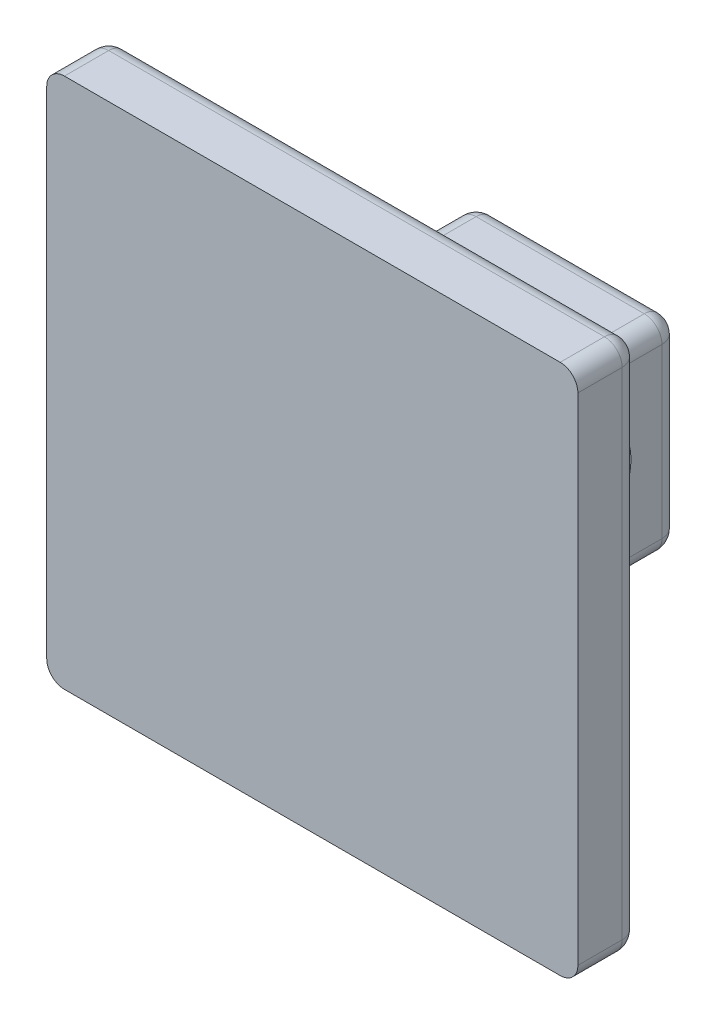
from build123d import *

# Parameters (mm, degrees)
ESBO_O1_W                = 23
ESBO_O1_H                = 23
RESSALTO_EXTRUS_O1_DEPTH = 23
ESBO_O3_W                = 60
ESBO_O3_H                = 60
RESSALTO_EXTRUS_O2_DEPTH = 7
ESBO_O6_R                = 6
CORTE_EXTRUS_O1_DEPTH    = 23
FILETE1_R                = 2
FILETE2_R                = 2
FILETE3_R                = 2


with BuildPart() as part:
    # Esboço1 → Ressalto-extrusão1 (new body)
    with BuildSketch(Plane.XY):
        Rectangle(ESBO_O1_W, ESBO_O1_H)
    extrude(amount=RESSALTO_EXTRUS_O1_DEPTH)

    # Esboço6 → Corte-extrusão1 (cut)
    with BuildSketch(Plane(origin=(11.5, 0, 0), x_dir=(0, 0, -1), z_dir=(1, 0, 0))):
        with Locations((-11.5, 0)):
            Circle(ESBO_O6_R)
    extrude(amount=-CORTE_EXTRUS_O1_DEPTH, mode=Mode.SUBTRACT)

    # Filete3
    filete3_edges = [part.edges().sort_by_distance(p)[0] for p in [
        (0, -11.5, 0),
        (-11.5, 0, 0),
        (0, 11.5, 0),
        (11.5, 0, 0),
        (11.5, -11.5, 11.5),
        (-11.5, -11.5, 11.5),
        (-11.5, 11.5, 11.5),
        (11.5, 11.5, 11.5),
    ]]
    fillet(filete3_edges, radius=FILETE3_R)


with BuildPart() as body_2:
    # Esboço3 → Ressalto-extrusão2 (new body)
    with BuildSketch(Plane.XY.offset(23)):
        Rectangle(ESBO_O3_W, ESBO_O3_H)
    extrude(amount=RESSALTO_EXTRUS_O2_DEPTH)

    # Filete1
    filete1_edges = [body_2.edges().sort_by_distance(p)[0] for p in [
        (0, 30, 23),
        (30, 0, 23),
        (0, -30, 23),
        (-30, 0, 23),
    ]]
    fillet(filete1_edges, radius=FILETE1_R)

    # Filete2
    # the kernel refuses this fillet: 2 mm, written as the material it takes off along each edge
    with BuildSketch(Plane(origin=(-28, -28, 25), x_dir=(-1, 0, 0), z_dir=(0, -1, 0))) as filete2_piece_1_section:
        Polygon((0, 0), (FILETE2_R, 0), (FILETE2_R, FILETE2_R), (0, FILETE2_R), align=None)
    filete2_piece_1 = extrude(amount=FILETE2_R, mode=Mode.PRIVATE)
    filete2_piece_1 = filete2_piece_1 - Plane(origin=(-28, -28, 25), x_dir=(0.7071067811865475, 0, 0.7071067811865475), z_dir=(0, -1, 0)) * Sphere(FILETE2_R, mode=Mode.PRIVATE)
    add(filete2_piece_1, mode=Mode.SUBTRACT)
    with BuildSketch(Plane(origin=(-28, 28, 25), x_dir=(0, 1, 0), z_dir=(-1, 0, 0))) as filete2_piece_2_section:
        Polygon((0, 0), (FILETE2_R, 0), (FILETE2_R, FILETE2_R), (0, FILETE2_R), align=None)
    filete2_piece_2 = extrude(amount=FILETE2_R, mode=Mode.PRIVATE)
    filete2_piece_2 = filete2_piece_2 - Plane(origin=(-28, 28, 25), x_dir=(0, -0.7071067811865475, 0.7071067811865475), z_dir=(-1, 0, 0)) * Sphere(FILETE2_R, mode=Mode.PRIVATE)
    add(filete2_piece_2, mode=Mode.SUBTRACT)
    with BuildSketch(Plane(origin=(28, -28, 25), x_dir=(1, 0, 0), z_dir=(0, -1, 0))) as filete2_piece_3_section:
        Polygon((0, 0), (FILETE2_R, 0), (FILETE2_R, -FILETE2_R), (0, -FILETE2_R), align=None)
    filete2_piece_3 = extrude(amount=FILETE2_R, mode=Mode.PRIVATE)
    filete2_piece_3 = filete2_piece_3 - Plane(origin=(28, -28, 25), x_dir=(-0.7071067811865475, 0, 0.7071067811865475), z_dir=(0, -1, 0)) * Sphere(FILETE2_R, mode=Mode.PRIVATE)
    add(filete2_piece_3, mode=Mode.SUBTRACT)
    with BuildSketch(Plane(origin=(28, 28, 25), x_dir=(0, 1, 0), z_dir=(1, 0, 0))) as filete2_piece_4_section:
        Polygon((0, 0), (FILETE2_R, 0), (FILETE2_R, -FILETE2_R), (0, -FILETE2_R), align=None)
    filete2_piece_4 = extrude(amount=FILETE2_R, mode=Mode.PRIVATE)
    filete2_piece_4 = filete2_piece_4 - Plane(origin=(28, 28, 25), x_dir=(0, -0.7071067811865475, 0.7071067811865475), z_dir=(1, 0, 0)) * Sphere(FILETE2_R, mode=Mode.PRIVATE)
    add(filete2_piece_4, mode=Mode.SUBTRACT)
    with BuildSketch(Plane(origin=(-30, 30, 25), x_dir=(0, -1, 0), z_dir=(0, 0, 1)), Plane(origin=(-30, -30, 25), x_dir=(1, 0, 0), z_dir=(0, 0, 1))) as filete2_piece_5:
        with BuildLine():
            CenterArc((FILETE2_R, FILETE2_R), FILETE2_R, 180, 90)
            Line((0, FILETE2_R), (0, 0))
            Line((0, 0), (FILETE2_R, 0))
        make_face()
    extrude(amount=10, mode=Mode.SUBTRACT)
    with BuildSketch(Plane(origin=(30, 30, 25), x_dir=(0, -1, 0), z_dir=(0, 0, 1)), Plane(origin=(30, -30, 25), x_dir=(-1, 0, 0), z_dir=(0, 0, 1))) as filete2_piece_6:
        with BuildLine():
            CenterArc((FILETE2_R, -FILETE2_R), FILETE2_R, 90, 90)
            Line((0, -FILETE2_R), (0, 0))
            Line((0, 0), (FILETE2_R, 0))
        make_face()
    extrude(amount=10, mode=Mode.SUBTRACT)


solid = Compound([part.part, body_2.part])
